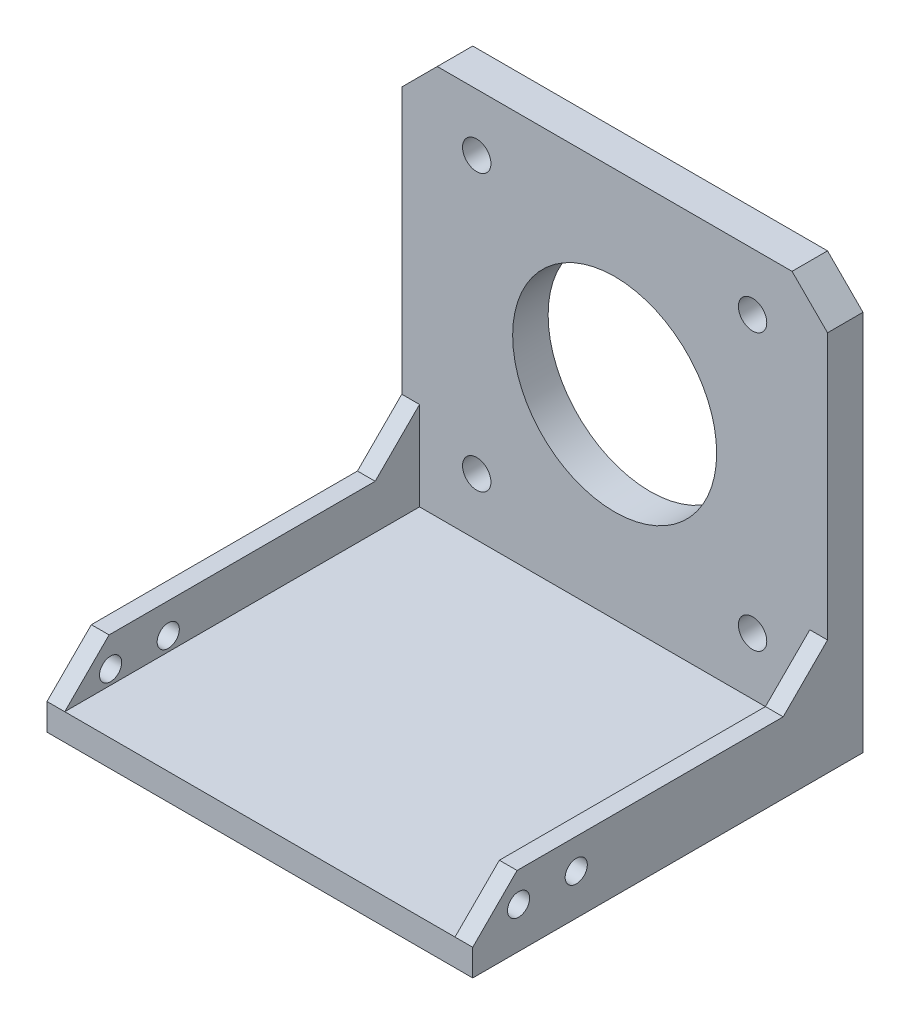
from build123d import *

# Parameters (mm, degrees)
SKIZZE1_W                       = 48
SKIZZE1_H                       = 44
AUFSATZ_LINEAR_AUSTRAGEN1_DEPTH = 3
SKIZZE2_W                       = 48
SKIZZE2_H                       = 4
AUFSATZ_LINEAR_AUSTRAGEN2_DEPTH = 44
SKIZZE3_R                       = 11.5
SKIZZE3_R_2                     = 1.6
SCHNITT_LINEAR_AUSTRAGEN1_DEPTH = 67.219332525
SKIZZE5_W                       = 2
SKIZZE5_H                       = 40
AUFSATZ_LINEAR_AUSTRAGEN3_DEPTH = 5
FASE2_SIZE                      = 5
FASE3_SIZE                      = 4
AUFSATZ_LINEAR_AUSTRAGEN4_DEPTH = 2
FASE4_SIZE                      = 2
SKIZZE8_R                       = 1.25
SCHNITT_LINEAR_AUSTRAGEN2_DEPTH = 71.689461732


with BuildPart() as part:
    # Skizze1 → Aufsatz-Linear austragen1 (new body)
    with BuildSketch(Plane(origin=(0, 0, 0), x_dir=(1, 0, 0), z_dir=(0, 1, 0))):
        Rectangle(SKIZZE1_W, SKIZZE1_H)
    extrude(amount=AUFSATZ_LINEAR_AUSTRAGEN1_DEPTH)

    # Skizze2 → Aufsatz-Linear austragen2 (add)
    with BuildSketch(Plane(origin=(0, 3, 0), x_dir=(1, 0, 0), z_dir=(0, 1, 0))):
        with Locations((0, 20)):
            Rectangle(SKIZZE2_W, SKIZZE2_H)
    extrude(amount=AUFSATZ_LINEAR_AUSTRAGEN2_DEPTH)

    # Skizze3 → Schnitt-Linear austragen1 (cut, through all)
    with BuildSketch(Plane.XY.offset(-18)):
        with Locations((0, 25)):
            Circle(SKIZZE3_R)
        with Locations((-15.55, 40.55)):
            Circle(SKIZZE3_R_2)
        with Locations((15.55, 40.55)):
            Circle(SKIZZE3_R_2)
        with Locations((15.55, 9.45)):
            Circle(SKIZZE3_R_2)
        with Locations((-15.55, 9.45)):
            Circle(SKIZZE3_R_2)
    extrude(amount=-SCHNITT_LINEAR_AUSTRAGEN1_DEPTH, mode=Mode.SUBTRACT)

    # Skizze5 → Aufsatz-Linear austragen3 (add)
    with BuildSketch(Plane(origin=(0, 3, 0), x_dir=(1, 0, 0), z_dir=(0, 1, 0))):
        with Locations((-23, -2)):
            Rectangle(SKIZZE5_W, SKIZZE5_H)
        with Locations((23, -2)):
            Rectangle(SKIZZE5_W, SKIZZE5_H)
    extrude(amount=AUFSATZ_LINEAR_AUSTRAGEN3_DEPTH)

    # Fase2
    fase2_edges = [part.edges().sort_by_distance(p)[0] for p in [
        (23, 8, -18),
        (-23, 8, 22),
        (-23, 8, -18),
        (23, 8, 22),
    ]]
    chamfer(fase2_edges, length=FASE2_SIZE)

    # Fase3
    fase3_edges = [part.edges().sort_by_distance(p)[0] for p in [
        (-24, 47, -20),
        (24, 47, -20),
    ]]
    chamfer(fase3_edges, length=FASE3_SIZE)

    # Skizze7 → Aufsatz-Linear austragen4 (add)
    with BuildSketch(Plane.XZ):
        Polygon((-1.75, 22), (1.75, 22), (1.75, 17.95), (1, 17.2), (-1, 17.2), (-1.75, 17.95), align=None)
    extrude(amount=AUFSATZ_LINEAR_AUSTRAGEN4_DEPTH)

    # Fase4
    fase4_edges = [part.edges().sort_by_distance(p)[0] for p in [
        (0, -2, 17.2),
        (0, -2, 22),
    ]]
    chamfer(fase4_edges, length=FASE4_SIZE - 0.0001)  # a hair under: the kernel refuses the full size

    # Skizze8 → Schnitt-Linear austragen2 (cut, through all)
    with BuildSketch(Plane.ZY.offset(24)):
        with Locations((16.83, 4.6)):
            Circle(SKIZZE8_R)
        with Locations((10.33, 4.6)):
            Circle(SKIZZE8_R)
    extrude(amount=-SCHNITT_LINEAR_AUSTRAGEN2_DEPTH, mode=Mode.SUBTRACT)


solid = part.part
